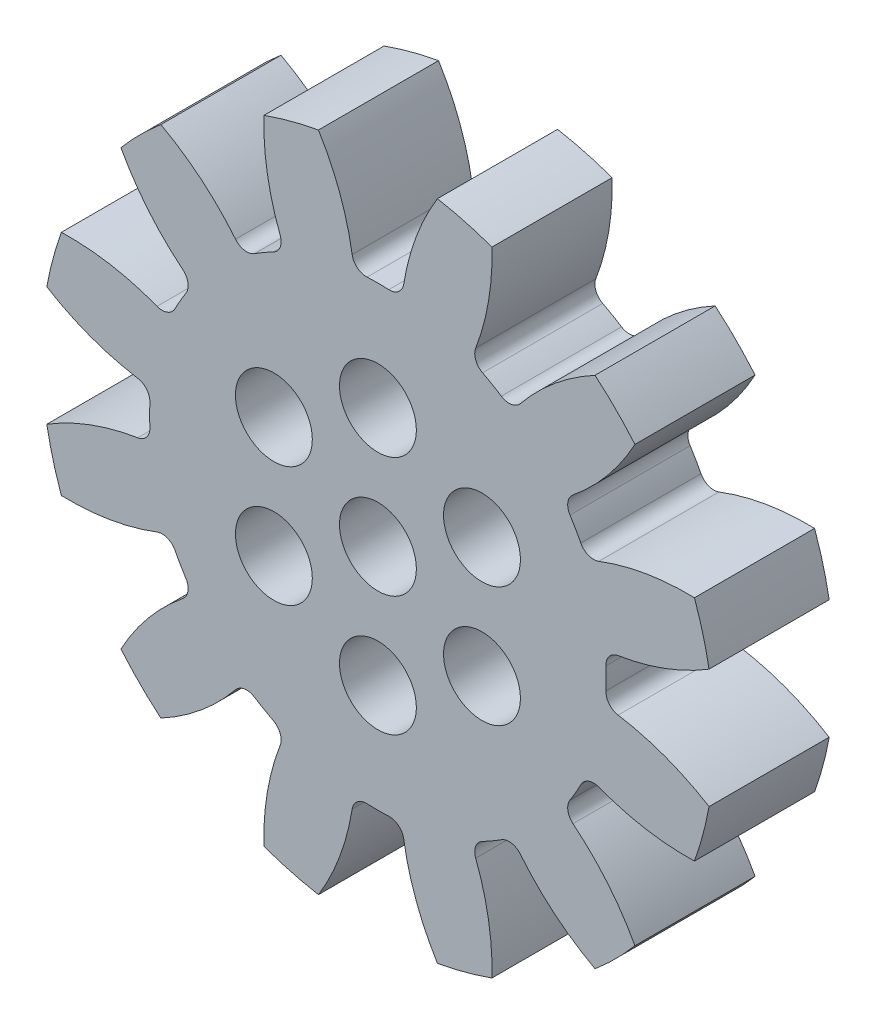
from build123d import *

# Parameters (mm, degrees)
SKETCH1_R                = 14
BOSS_EXTRUDE1_DEPTH      = 2.5
CUT_EXTRUDE1_DEPTH       = 20.956202043
FILLET1_R                = 0.6
FILLET2_R                = 0.6
CIRPATTERN2_COUNT        = 12
FILLET1_OF_CIRPATTERN2_R = 0.6
FILLET2_OF_CIRPATTERN2_R = 0.6
CUT_EXTRUDE2_DEPTH       = 21.118127499
CUT_EXTRUDE2_DEPTH_BACK  = 21.118127499
SKETCH4_R                = 1.5
SKETCH5_R                = 1.6
CUT_EXTRUDE3_DEPTH       = 21.118127499


with BuildPart() as part:
    # Sketch1 → Boss-Extrude1 (new, symmetric)
    with BuildSketch(Plane.XY):
        Circle(SKETCH1_R)
    extrude(amount=BOSS_EXTRUDE1_DEPTH, both=True)

    # Sketch2 → Cut-Extrude1 (cut, symmetric)
    with BuildSketch(Plane.XY):
        with BuildLine():
            ThreePointArc((-3.314591405, 14.951229823), (-1.751535203, 12.36983933), (-0.999747632, 9.447248524))
            ThreePointArc((-0.999747632, 9.447248524), (0, 9.5), (0.999747632, 9.447248524))
            ThreePointArc((0.999747632, 9.447248524), (1.751535203, 12.36983933), (3.314591405, 14.951229823))
            ThreePointArc((3.314591405, 14.951229823), (0, 15.314234862), (-3.314591405, 14.951229823))
        make_face()
    cut_extrude1 = extrude(amount=CUT_EXTRUDE1_DEPTH, both=True, mode=Mode.SUBTRACT)

    # Fillet1
    fillet1_edges = [part.edges().sort_by_distance(p)[0] for p in [
        (-0.999747632, 9.447248524, 0),
    ]]
    fillet(fillet1_edges, radius=FILLET1_R)

    # Fillet2
    fillet2_edges = [part.edges().sort_by_distance(p)[0] for p in [
        (0.999747632, 9.447248524, 0),
    ]]
    fillet(fillet2_edges, radius=FILLET2_R)

    # CirPattern2: Cut-Extrude1 ×12 about axis
    cirpattern2_axis = Axis((0, 0, 2.5), (0, 0, 1))
    for i in range(1, CIRPATTERN2_COUNT):
        add(cut_extrude1.rotate(cirpattern2_axis, i * 360 / CIRPATTERN2_COUNT), mode=Mode.SUBTRACT)

    # Fillet1 of CirPattern2
    fillet1_of_cirpattern2_edges = [part.edges().sort_by_distance(p)[0] for p in [
        (-5.589431109, 7.681683401, 0),
        (-8.681431034, 3.857817415, 0),
        (-9.447248524, -0.999747632, 0),
        (-7.681683401, -5.589431109, 0),
        (-3.857817415, -8.681431034, 0),
        (0.999747632, -9.447248524, 0),
        (5.589431109, -7.681683401, 0),
        (8.681431034, -3.857817415, 0),
        (9.447248524, 0.999747632, 0),
        (7.681683401, 5.589431109, 0),
        (3.857817415, 8.681431034, 0),
    ]]
    fillet(fillet1_of_cirpattern2_edges, radius=FILLET1_OF_CIRPATTERN2_R)

    # Fillet2 of CirPattern2
    fillet2_of_cirpattern2_edges = [part.edges().sort_by_distance(p)[0] for p in [
        (-3.857817415, 8.681431034, 0),
        (-7.681683401, 5.589431109, 0),
        (-9.447248524, 0.999747632, 0),
        (-8.681431034, -3.857817415, 0),
        (-5.589431109, -7.681683401, 0),
        (-0.999747632, -9.447248524, 0),
        (3.857817415, -8.681431034, 0),
        (7.681683401, -5.589431109, 0),
        (9.447248524, -0.999747632, 0),
        (8.681431034, 3.857817415, 0),
        (5.589431109, 7.681683401, 0),
    ]]
    fillet(fillet2_of_cirpattern2_edges, radius=FILLET2_OF_CIRPATTERN2_R)

    # Sketch4 → Cut-Extrude2 (cut, two sides: drawn at the far end of the back side and taken through both)
    with BuildSketch(Plane.XY.offset(2.5).offset(-CUT_EXTRUDE2_DEPTH_BACK)):
        Circle(SKETCH4_R)
        with Locations((0, 5)):
            Circle(SKETCH4_R)
        with Locations((4.330127019, 2.5)):
            Circle(SKETCH4_R)
        with Locations((4.330127019, -2.5)):
            Circle(SKETCH4_R)
        with Locations((0, -5)):
            Circle(SKETCH4_R)
        with Locations((-4.330127019, -2.5)):
            Circle(SKETCH4_R)
        with Locations((-4.330127019, 2.5)):
            Circle(SKETCH4_R)
    extrude(amount=CUT_EXTRUDE2_DEPTH + CUT_EXTRUDE2_DEPTH_BACK, mode=Mode.SUBTRACT)

    # Sketch5 → Cut-Extrude3 (cut, through all)
    with BuildSketch(Plane.XY.offset(2.5)):
        with Locations((0, 5)):
            Circle(SKETCH5_R)
        with Locations((4.330127019, 2.5)):
            Circle(SKETCH5_R)
        with Locations((4.330127019, -2.5)):
            Circle(SKETCH5_R)
        with Locations((0, -5)):
            Circle(SKETCH5_R)
        Circle(SKETCH5_R)
        with Locations((-4.330127019, -2.5)):
            Circle(SKETCH5_R)
        with Locations((-4.330127019, 2.5)):
            Circle(SKETCH5_R)
    extrude(amount=-CUT_EXTRUDE3_DEPTH, mode=Mode.SUBTRACT)


solid = part.part
